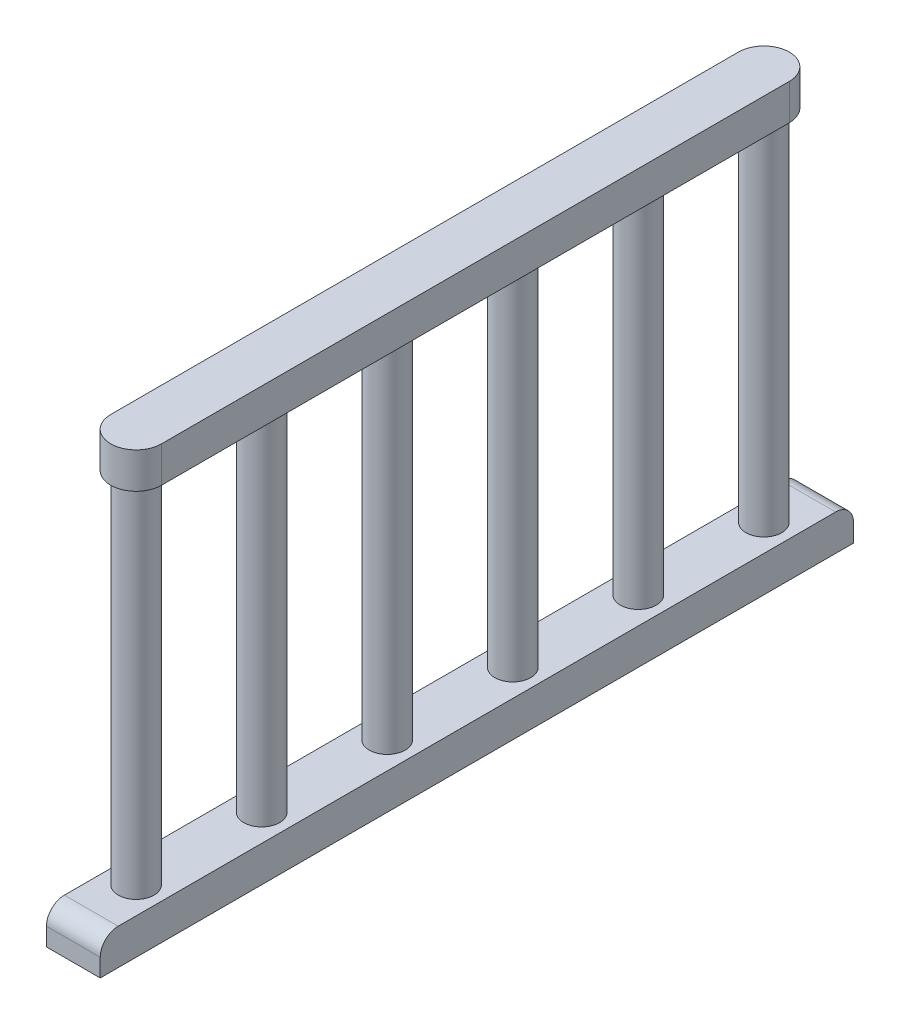
from build123d import *

# Parameters (mm, degrees)
SKETCH2_W               = 150
SKETCH2_H               = 2100
BOSS_EXTRUDE3_DEPTH     = 100
BOSS_EXTRUDE3_2_DEPTH   = 100
SKETCH3_R               = 50
BOSS_EXTRUDE4_DEPTH     = 1000
LPATTERN1_COUNT         = 6
LPATTERN1_PITCH         = 350
SKETCH5_R               = 50
BOSS_EXTRUDE5_DEPTH     = 1000
LPATTERN2_COUNT         = 6
LPATTERN2_PITCH         = 350
FILLET1_R               = 50
FILLET2_R               = 50
FILLET3_R               = 50
FILLET4_R               = 50
BOSS_EXTRUDE8_DEPTH     = 100
CUT_EXTRUDE1_DEPTH      = 2000
CUT_EXTRUDE1_DEPTH_BACK = 2000
SKETCH14_W              = 805.257541721
SKETCH14_H              = 2502.966116942


with BuildPart() as part:
    # Sketch2 → Boss-Extrude3 (new body)
    with BuildSketch(Plane(origin=(0, 0, 0), x_dir=(1, 0, 0), z_dir=(0, 1, 0))):
        with Locations((1775, 1037.975951904)):
            Rectangle(SKETCH2_W, SKETCH2_H)
    extrude(amount=BOSS_EXTRUDE3_DEPTH)

    # Sketch5 → Boss-Extrude5 (add)
    with BuildSketch(Plane(origin=(0, 100, 0), x_dir=(1, 0, 0), z_dir=(0, 1, 0))):
        with Locations((1775, 1912.975951904)):
            Circle(SKETCH5_R)
    boss_extrude5 = extrude(amount=BOSS_EXTRUDE5_DEPTH)

    # LPattern2: Boss-Extrude5 ×6
    with Locations(*[(0, 0, i * LPATTERN2_PITCH) for i in range(1, LPATTERN2_COUNT)]):
        add(boss_extrude5)

    # Fillet3
    fillet3_edges = [part.edges().sort_by_distance(p)[0] for p in [
        (1775, 100, 12.024048096),
    ]]
    fillet(fillet3_edges, radius=FILLET3_R)

    # Fillet4
    fillet4_edges = [part.edges().sort_by_distance(p)[0] for p in [
        (1775, 100, -2087.975951904),
    ]]
    fillet(fillet4_edges, radius=FILLET4_R)



with BuildPart() as body_2:
    # Sketch2 → Boss-Extrude3 2 (new body)
    with BuildSketch(Plane(origin=(0, 0, 0), x_dir=(1, 0, 0), z_dir=(0, 1, 0))):
        with Locations((-1775, 1037.975951904)):
            Rectangle(SKETCH2_W, SKETCH2_H)
    extrude(amount=BOSS_EXTRUDE3_2_DEPTH)

    # Sketch3 → Boss-Extrude4 (add)
    with BuildSketch(Plane(origin=(0, 100, 0), x_dir=(1, 0, 0), z_dir=(0, 1, 0))):
        with Locations((-1775, 162.975951904)):
            Circle(SKETCH3_R)
    boss_extrude4 = extrude(amount=BOSS_EXTRUDE4_DEPTH)

    # LPattern1: Boss-Extrude4 ×6
    with Locations(*[(0, 0, -i * LPATTERN1_PITCH) for i in range(1, LPATTERN1_COUNT)]):
        add(boss_extrude4)

    # Fillet1
    fillet1_edges = [body_2.edges().sort_by_distance(p)[0] for p in [
        (-1775, 100, -2087.975951904),
    ]]
    fillet(fillet1_edges, radius=FILLET1_R)

    # Fillet2
    fillet2_edges = [body_2.edges().sort_by_distance(p)[0] for p in [
        (-1775, 100, 12.024048096),
    ]]
    fillet(fillet2_edges, radius=FILLET2_R)


with BuildPart() as part_1:
    add(part.part)

    add(body_2.part)  # Boss-Extrude8 merges body 2
    # Sketch13 → Boss-Extrude8 (add)
    with BuildSketch(Plane(origin=(0, 1100, 0), x_dir=(1, 0, 0), z_dir=(0, 1, 0))):
        with BuildLine():
            Line((-1845.838339321, 162.975951904), (-1845.838339321, 1912.975951904))
            ThreePointArc((-1845.838339321, 1912.975951904), (-1775, 1983.814291225), (-1704.161660679, 1912.975951904))
            Line((-1704.161660679, 1912.975951904), (-1704.161660679, 162.975951904))
            ThreePointArc((-1704.161660679, 162.975951904), (-1775, 92.137612583), (-1845.838339321, 162.975951904))
        make_face()
        with BuildLine():
            Line((1845.838339321, 162.975951904), (1845.838339321, 1912.975951904))
            ThreePointArc((1845.838339321, 1912.975951904), (1775, 1983.814291225), (1704.161660679, 1912.975951904))
            Line((1704.161660679, 1912.975951904), (1704.161660679, 162.975951904))
            ThreePointArc((1704.161660679, 162.975951904), (1775, 92.137612583), (1845.838339321, 162.975951904))
        make_face()
    extrude(amount=BOSS_EXTRUDE8_DEPTH)

    # Sketch14 → Cut-Extrude1 (cut, two sides: drawn at the far end of the back side and taken through both)
    with BuildSketch(Plane(origin=(0, 1100, 0), x_dir=(1, 0, 0), z_dir=(0, 1, 0)).offset(-CUT_EXTRUDE1_DEPTH_BACK)):
        with Locations((-1496.523875696, 935.395373341)):
            Rectangle(SKETCH14_W, SKETCH14_H)
    extrude(amount=CUT_EXTRUDE1_DEPTH + CUT_EXTRUDE1_DEPTH_BACK, mode=Mode.SUBTRACT)


solid = part_1.part
